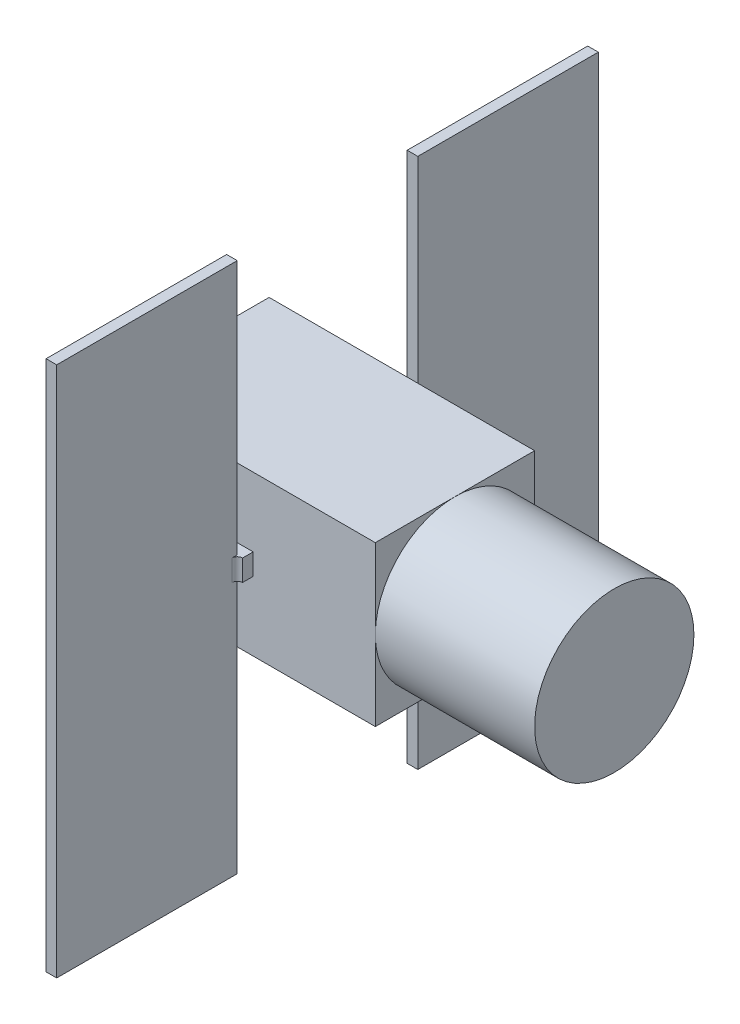
from build123d import *

# Parameters (mm, degrees)
BOSS_EXTRUDE1_DEPTH      = 150
BOSS_EXTRUDE1_DEPTH_BACK = 150
SKETCH1_W                = 500
SKETCH1_H                = 300
SKETCH2_W                = 40
SKETCH2_H                = 40
BOSS_EXTRUDE2_DEPTH      = 20
SKETCH3_W                = 20
SKETCH3_H                = 1000
BOSS_EXTRUDE3_DEPTH      = 340
FILLET1_R                = 10
SKETCH4_R                = 40
BOSS_EXTRUDE4_DEPTH      = 150
SKETCH5_R                = 10
BOSS_EXTRUDE5_DEPTH      = 50
FILLET1_OF_MIRROR1_R     = 10
SKETCH7_R                = 150
BOSS_EXTRUDE6_DEPTH      = 300


with BuildPart() as part:
    # Sketch1 → Boss-Extrude1 (new, two sides: drawn at the far end of the back side and taken through both)
    with BuildSketch(Plane.XY.offset(-BOSS_EXTRUDE1_DEPTH_BACK)):
        Rectangle(SKETCH1_W, SKETCH1_H)
    extrude(amount=BOSS_EXTRUDE1_DEPTH + BOSS_EXTRUDE1_DEPTH_BACK)

    # Sketch2 → Boss-Extrude2 (add)
    with BuildSketch(Plane.XY.offset(150)):
        Rectangle(SKETCH2_W, SKETCH2_H)
    boss_extrude2 = extrude(amount=BOSS_EXTRUDE2_DEPTH)

    # Sketch3 → Boss-Extrude3 (add)
    with BuildSketch(Plane.XY.offset(170)):
        Rectangle(SKETCH3_W, SKETCH3_H)
    boss_extrude3 = extrude(amount=BOSS_EXTRUDE3_DEPTH)

    # Fillet1
    fillet1_edges = [part.edges().sort_by_distance(p)[0] for p in [
        (-10, 0, 170),
        (10, 0, 170),
    ]]
    fillet(fillet1_edges, radius=FILLET1_R - 0.0001)  # a hair under: the kernel refuses the full size

    # Sketch4 → Boss-Extrude4 (add)
    with BuildSketch(Plane.ZY.offset(250)):
        with Locations((58.043987529, 0)):
            Circle(SKETCH4_R)
    boss_extrude4 = extrude(amount=BOSS_EXTRUDE4_DEPTH)

    # Sketch5 → Boss-Extrude5 (add)
    with BuildSketch(Plane.ZY.offset(400)):
        with Locations((58.043987529, 0)):
            Circle(SKETCH5_R)
    boss_extrude5 = extrude(amount=BOSS_EXTRUDE5_DEPTH)

    # Mirror1: Boss-Extrude2, Boss-Extrude3, Boss-Extrude4, Boss-Extrude5 across plane
    add(boss_extrude2.mirror(Plane.XY))
    add(boss_extrude3.mirror(Plane.XY))
    add(boss_extrude4.mirror(Plane.XY))
    add(boss_extrude5.mirror(Plane.XY))

    # Fillet1 of Mirror1
    fillet1_of_mirror1_edges = [part.edges().sort_by_distance(p)[0] for p in [
        (-10, 0, -170),
        (10, 0, -170),
    ]]
    fillet(fillet1_of_mirror1_edges, radius=FILLET1_OF_MIRROR1_R - 0.0001)  # a hair under: the kernel refuses the full size

    # Sketch7 → Boss-Extrude6 (add)
    with BuildSketch(Plane(origin=(250, 0, 0), x_dir=(0, 0, -1), z_dir=(1, 0, 0))):
        Circle(SKETCH7_R)
    extrude(amount=BOSS_EXTRUDE6_DEPTH)


solid = part.part
